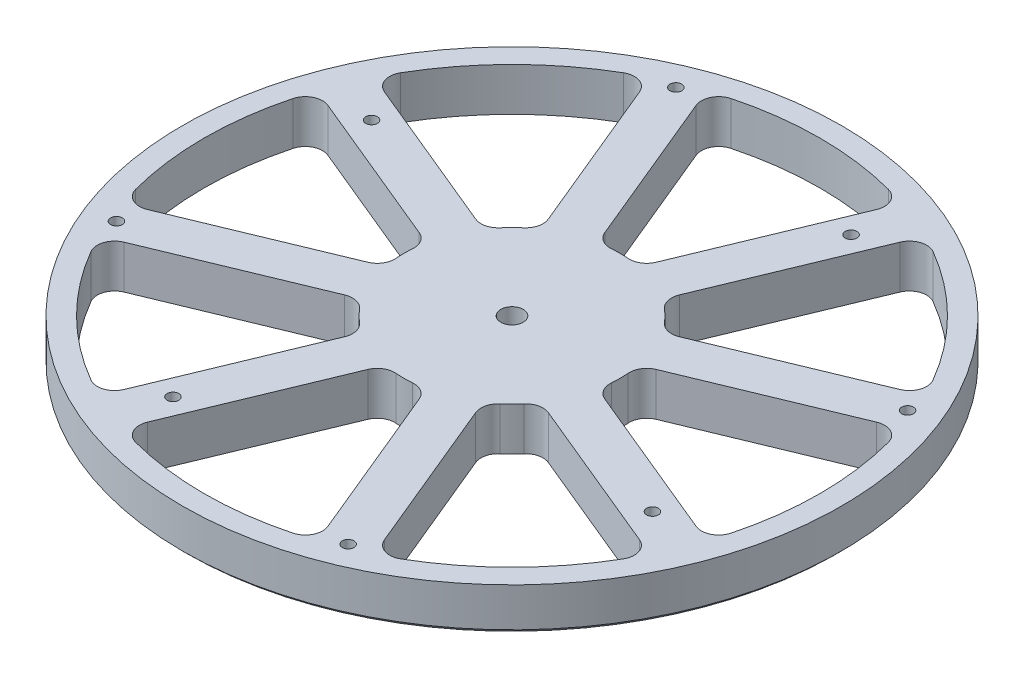
from build123d import *

# Parameters (mm, degrees)
SKETCH2_W                  = 76.2
SKETCH2_H                  = 10
F_6_32_TAPPED_HOLE1_D      = 2.7051
CIRPATTERN3_COUNT          = 4
CUT_EXTRUDE1_DEPTH         = 109.226059708
FILLET1_R                  = 4
CIRPATTERN4_COUNT          = 8
FILLET1_OF_CIRPATTERN4_R   = 4
CHAMFER2_SIZE              = 1
F_6_0_204_DIAMETER_HOLE2_D = 5.1816


with BuildPart() as part:
    # Sketch2 → Revolve1 (revolve)
    with BuildSketch(Plane(origin=(0, 0, 0), x_dir=(0, 0, -1), z_dir=(1, 0, 0))):
        with Locations((-38.1, 5)):
            Rectangle(SKETCH2_W, SKETCH2_H)
    revolve(axis=Axis((0, -0.5, 0), (0, 1, 0)))

    # #6-32 Tapped Hole1 (through all)
    with Locations(Plane(origin=(0, 10, 0), x_dir=(1, 0, 0), z_dir=(0, 1, 0))):
        with Locations((-26.787840266, 64.671567276), (-55.432771951, 22.961005942)):
            f_6_32_tapped_hole1 = Hole(F_6_32_TAPPED_HOLE1_D / 2)

    # CirPattern3: #6-32 Tapped Hole1 ×4 about axis
    cirpattern3_axis = Axis((0, -0.5, 0), (0, 1, 0))
    for i in range(1, CIRPATTERN3_COUNT):
        add(f_6_32_tapped_hole1.rotate(cirpattern3_axis, i * 360 / CIRPATTERN3_COUNT), mode=Mode.SUBTRACT)

    # Sketch8 → Cut-Extrude1 (cut, through all)
    with BuildSketch(Plane(origin=(0, 10, 0), x_dir=(1, 0, 0), z_dir=(0, 1, 0))):
        with BuildLine():
            Line((-4.754393761, 24.543751546), (-22.560395095, 67.53124146))
            ThreePointArc((-22.560395095, 67.53124146), (0, 71.2), (22.560395095, 67.53124146))
            Line((22.560395095, 67.53124146), (4.754393761, 24.543751546))
            ThreePointArc((4.754393761, 24.543751546), (0, 25), (-4.754393761, 24.543751546))
        make_face()
    cut_extrude1 = extrude(amount=-CUT_EXTRUDE1_DEPTH, mode=Mode.SUBTRACT)

    # Fillet1
    fillet1_edges = [part.edges().sort_by_distance(p)[0] for p in [
        (4.754393761, 5, -24.543751546),
        (22.560395095, 5, -67.53124146),
        (-4.754393761, 5, -24.543751546),
        (-22.560395095, 5, -67.53124146),
    ]]
    fillet(fillet1_edges, radius=FILLET1_R)

    # CirPattern4: Cut-Extrude1 ×8 about axis
    cirpattern4_axis = Axis((0, -0.5, 0), (0, 1, 0))
    for i in range(1, CIRPATTERN4_COUNT):
        add(cut_extrude1.rotate(cirpattern4_axis, i * 360 / CIRPATTERN4_COUNT), mode=Mode.SUBTRACT)

    # Fillet1 of CirPattern4
    fillet1_of_cirpattern4_edges = [part.edges().sort_by_distance(p)[0] for p in [
        (-13.993189086, 5, -20.716917223),
        (-31.79919042, 5, -63.704407136),
        (-20.716917223, 5, -13.993189086),
        (-63.704407136, 5, -31.79919042),
        (-24.543751546, 5, -4.754393761),
        (-67.53124146, 5, -22.560395095),
        (-24.543751546, 5, 4.754393761),
        (-67.53124146, 5, 22.560395095),
        (-20.716917223, 5, 13.993189086),
        (-63.704407136, 5, 31.79919042),
        (-13.993189086, 5, 20.716917223),
        (-31.79919042, 5, 63.704407136),
        (-4.754393761, 5, 24.543751546),
        (-22.560395095, 5, 67.53124146),
        (4.754393761, 5, 24.543751546),
        (22.560395095, 5, 67.53124146),
        (13.993189086, 5, 20.716917223),
        (31.79919042, 5, 63.704407136),
        (20.716917223, 5, 13.993189086),
        (63.704407136, 5, 31.79919042),
        (24.543751546, 5, 4.754393761),
        (67.53124146, 5, 22.560395095),
        (24.543751546, 5, -4.754393761),
        (67.53124146, 5, -22.560395095),
        (20.716917223, 5, -13.993189086),
        (63.704407136, 5, -31.79919042),
        (13.993189086, 5, -20.716917223),
        (31.79919042, 5, -63.704407136),
    ]]
    fillet(fillet1_of_cirpattern4_edges, radius=FILLET1_OF_CIRPATTERN4_R)

    # Chamfer2
    chamfer2_edges = [part.edges().sort_by_distance(p)[0] for p in [
        (0, 0, -76.2),
    ]]
    chamfer(chamfer2_edges, length=CHAMFER2_SIZE)

    # #6 (0.204) Diameter Hole2 (through all)
    with Locations(Plane(origin=(0, 0, 0), x_dir=(-1, 0, 0), z_dir=(0, -1, 0))):
        with Locations((0, 0)):
            Hole(F_6_0_204_DIAMETER_HOLE2_D / 2)


solid = part.part
